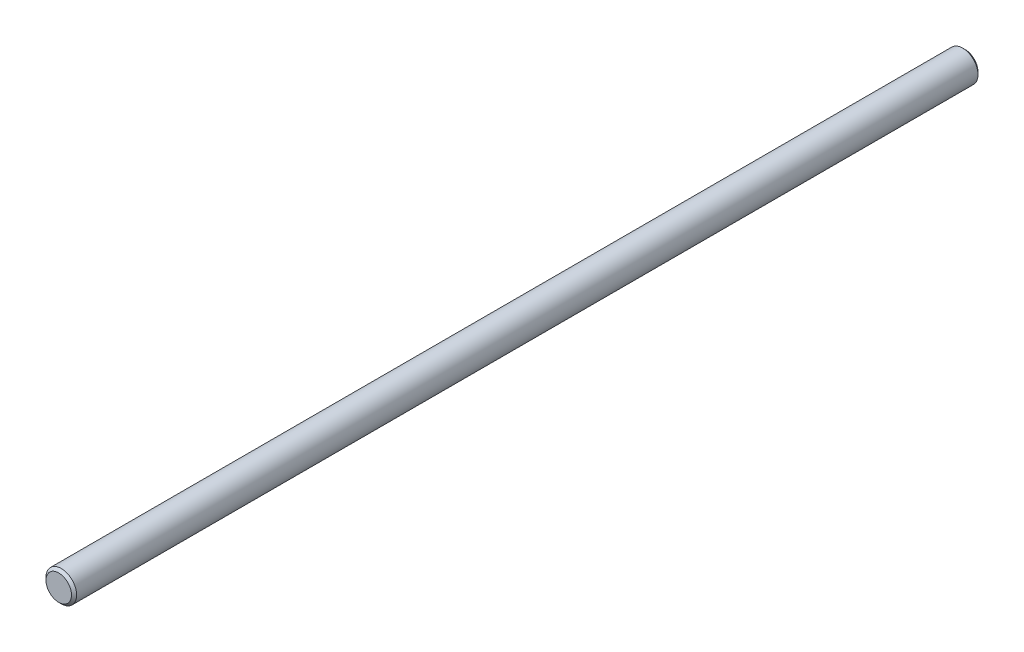
from build123d import *

# Parameters (mm, degrees)
SCHIZZO1_R                   = 6
ESTRUSIONE_ESTRUSIONE1_DEPTH = 355
SMUSSO1_SIZE                 = 1


with BuildPart() as part:
    # Schizzo1 → Estrusione-Estrusione1 (new body)
    with BuildSketch(Plane.XY):
        Circle(SCHIZZO1_R)
    extrude(amount=ESTRUSIONE_ESTRUSIONE1_DEPTH)

    # Smusso1
    smusso1_edges = [part.edges().sort_by_distance(p)[0] for p in [
        (-6, 0, 355),
        (-6, 0, 0),
    ]]
    chamfer(smusso1_edges, length=SMUSSO1_SIZE)


solid = part.part
